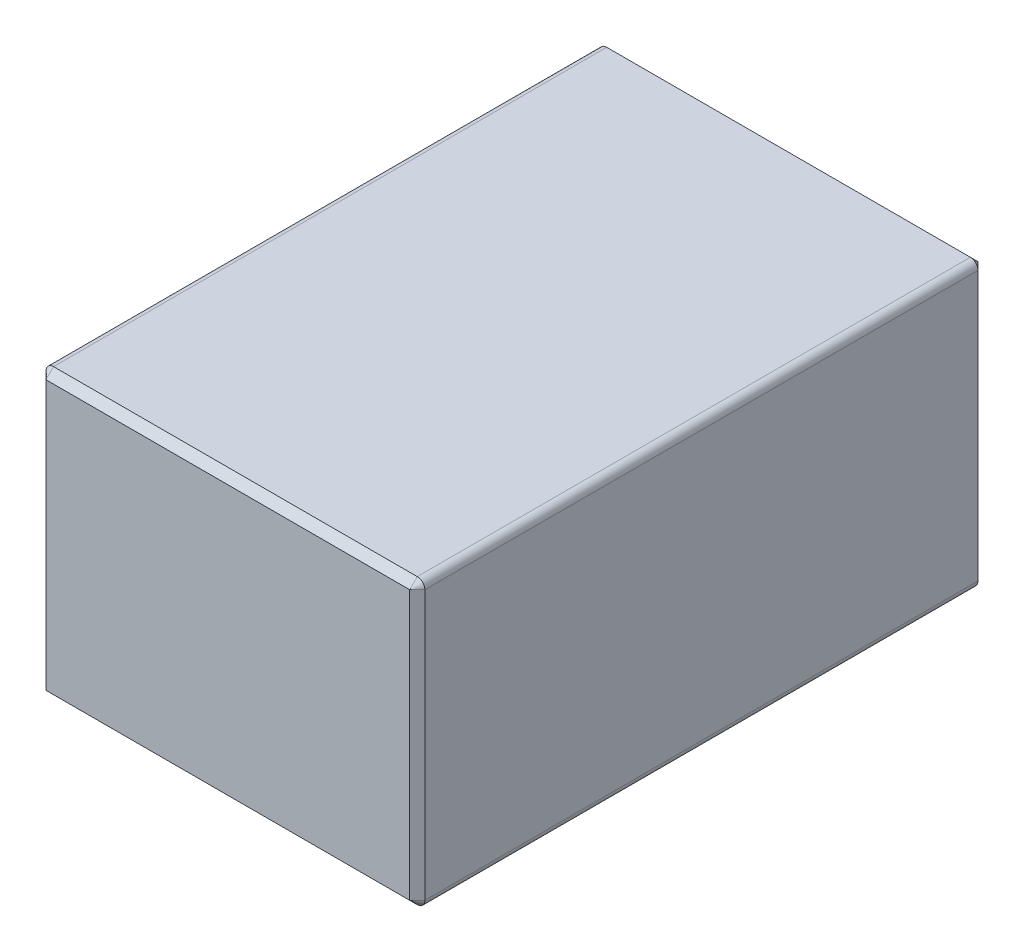
from build123d import *

# Parameters (mm, degrees)
SKETCH1_W           = 100
SKETCH1_H           = 150
BOSS_EXTRUDE1_DEPTH = 75
FILLET1_R           = 2
CHAMFER1_SIZE       = 2


with BuildPart() as part:
    # Sketch1 → Boss-Extrude1 (new body)
    with BuildSketch(Plane(origin=(0, 0, 0), x_dir=(1, 0, 0), z_dir=(0, 1, 0))):
        Rectangle(SKETCH1_W, SKETCH1_H)
    extrude(amount=BOSS_EXTRUDE1_DEPTH)

    # Fillet1
    fillet1_edges = [part.edges().sort_by_distance(p)[0] for p in [
        (-50, 75, 0),
        (50, 75, 0),
        (-50, 0, 0),
        (50, 0, 0),
    ]]
    fillet(fillet1_edges, radius=FILLET1_R)

    # Chamfer1
    chamfer1_edges = [part.edges().sort_by_distance(p)[0] for p in [
        (-50, 37.5, 75),
        (-50, 37.5, -75),
        (0, 0, 75),
        (50, 37.5, 75),
        (0, 75, 75),
        (49.414213562, 74.414213562, 75),
        (-49.414213562, 74.414213562, 75),
        (49.414213562, 0.585786438, 75),
        (-49.414213562, 0.585786438, 75),
        (0, 0, -75),
        (0, 75, -75),
        (50, 37.5, -75),
        (49.414213562, 74.414213562, -75),
        (-49.414213562, 74.414213562, -75),
        (49.414213562, 0.585786438, -75),
        (-49.414213562, 0.585786438, -75),
    ]]
    chamfer(chamfer1_edges, length=CHAMFER1_SIZE - 0.0001)  # a hair under: the kernel refuses the full size


solid = part.part
